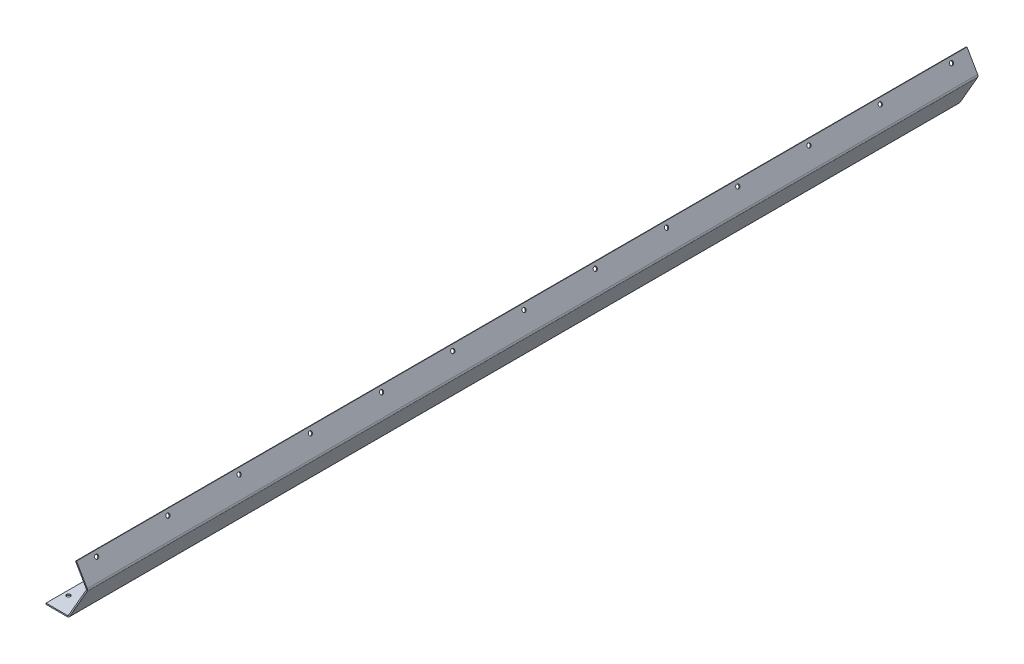
from build123d import *

# Parameters (mm, degrees)
SKETCH2_W           = 18
SKETCH2_H           = 1
BOSS_EXTRUDE2_DEPTH = 750
EDGE_FLANGE9_DEPTH  = 750
EDGE_FLANGE10_DEPTH = 750
SKETCH50_R          = 1.6
CUT_EXTRUDE1_DEPTH  = 10
SKETCH51_R          = 1.6
CUT_EXTRUDE2_DEPTH  = 10


# Sheet-metal steps are written as plain solids
with BuildPart() as part:
    # Sketch2 → Boss-Extrude2 (new body)
    with BuildSketch(Plane.XY):
        with Locations((-101.157096866, 298.73456983)):
            Rectangle(SKETCH2_W, SKETCH2_H)
    extrude(amount=BOSS_EXTRUDE2_DEPTH)

    # Edge-Flange9 section (across the edge) → Edge-Flange9 (add)
    with BuildSketch(Plane(origin=(-91.52201157, 299.23456983, 750), x_dir=(-0.8660254037844364, 0.5000000000000041, 0), z_dir=(0, 0, -1))):
        with BuildLine():
            Line((-1, 0.635085296), (-1, 30.422649731))
            Line((-1, 30.422649731), (0, 30.422649731))
            Line((0, 30.422649731), (0, 0.635085296))
            ThreePointArc((0, 0.635085296), (0.147372056, 0.085085296), (0.55, -0.317542648))
            Line((0.55, -0.317542648), (0.05, -1.183568052))
            ThreePointArc((0.05, -1.183568052), (-0.718653348, -0.414914704), (-1, 0.635085296))
        make_face()
    extrude(amount=EDGE_FLANGE9_DEPTH)

    # Edge-Flange10 section (across the edge) → Edge-Flange10 (add)
    with BuildSketch(Plane(origin=(-75.993144057, 326.131357347, 750), x_dir=(-0.8660254037844436, -0.49999999999999156, 0), z_dir=(0, 0, -1))):
        with BuildLine():
            Line((-1, 0.635085296), (-1, 18.64))
            Line((-1, 18.64), (0, 18.64))
            Line((0, 18.64), (0, 0.635085296))
            ThreePointArc((0, 0.635085296), (0.147372056, 0.085085296), (0.55, -0.317542648))
            Line((0.55, -0.317542648), (0.05, -1.183568052))
            ThreePointArc((0.05, -1.183568052), (-0.718653348, -0.414914704), (-1, 0.635085296))
        make_face()
    extrude(amount=EDGE_FLANGE10_DEPTH)

    # Sketch50 → Cut-Extrude1 (cut)
    with BuildSketch(Plane.XZ.offset(-298.23456983)):
        with Locations(Location((-106.227096866, 735, 0), (0, 0, 270))):
            Circle(SKETCH50_R)
        with Locations(Location((-106.227096866, 15, 0), (0, 0, 270))):
            Circle(SKETCH50_R)
        with Locations(Location((-106.227096866, 75, 0), (0, 0, 270))):
            Circle(SKETCH50_R)
        with Locations(Location((-106.227096866, 135, 0), (0, 0, 270))):
            Circle(SKETCH50_R)
        with Locations(Location((-106.227096866, 195, 0), (0, 0, 270))):
            Circle(SKETCH50_R)
        with Locations(Location((-106.227096866, 255, 0), (0, 0, 270))):
            Circle(SKETCH50_R)
        with Locations(Location((-106.227096866, 315, 0), (0, 0, 270))):
            Circle(SKETCH50_R)
        with Locations(Location((-106.227096866, 375, 0), (0, 0, 270))):
            Circle(SKETCH50_R)
        with Locations(Location((-106.227096866, 435, 0), (0, 0, 270))):
            Circle(SKETCH50_R)
        with Locations(Location((-106.227096866, 495, 0), (0, 0, 270))):
            Circle(SKETCH50_R)
        with Locations(Location((-106.227096866, 555, 0), (0, 0, 270))):
            Circle(SKETCH50_R)
        with Locations(Location((-106.227096866, 615, 0), (0, 0, 270))):
            Circle(SKETCH50_R)
        with Locations(Location((-106.227096866, 675, 0), (0, 0, 270))):
            Circle(SKETCH50_R)
    extrude(amount=-CUT_EXTRUDE1_DEPTH, mode=Mode.SUBTRACT)

    # Sketch51 → Cut-Extrude2 (cut)
    with BuildSketch(Plane(origin=(85.090187578, 49.126842704, 0), x_dir=(0, 0, -1), z_dir=(0.8660254037844434, 0.499999999999992, 0))):
        with Locations(Location((-735, 335.144612461, 0), (0, 0, 90))):
            Circle(SKETCH51_R)
        with Locations(Location((-15, 335.144612461, 0), (0, 0, 90))):
            Circle(SKETCH51_R)
        with Locations(Location((-75, 335.144612461, 0), (0, 0, 90))):
            Circle(SKETCH51_R)
        with Locations(Location((-135, 335.144612461, 0), (0, 0, 90))):
            Circle(SKETCH51_R)
        with Locations(Location((-195, 335.144612461, 0), (0, 0, 90))):
            Circle(SKETCH51_R)
        with Locations(Location((-255, 335.144612461, 0), (0, 0, 90))):
            Circle(SKETCH51_R)
        with Locations(Location((-315, 335.144612461, 0), (0, 0, 90))):
            Circle(SKETCH51_R)
        with Locations(Location((-375, 335.144612461, 0), (0, 0, 90))):
            Circle(SKETCH51_R)
        with Locations(Location((-435, 335.144612461, 0), (0, 0, 90))):
            Circle(SKETCH51_R)
        with Locations(Location((-495, 335.144612461, 0), (0, 0, 90))):
            Circle(SKETCH51_R)
        with Locations(Location((-555, 335.144612461, 0), (0, 0, 90))):
            Circle(SKETCH51_R)
        with Locations(Location((-615, 335.144612461, 0), (0, 0, 90))):
            Circle(SKETCH51_R)
        with Locations(Location((-675, 335.144612461, 0), (0, 0, 90))):
            Circle(SKETCH51_R)
    extrude(amount=-CUT_EXTRUDE2_DEPTH, mode=Mode.SUBTRACT)


solid = part.part
